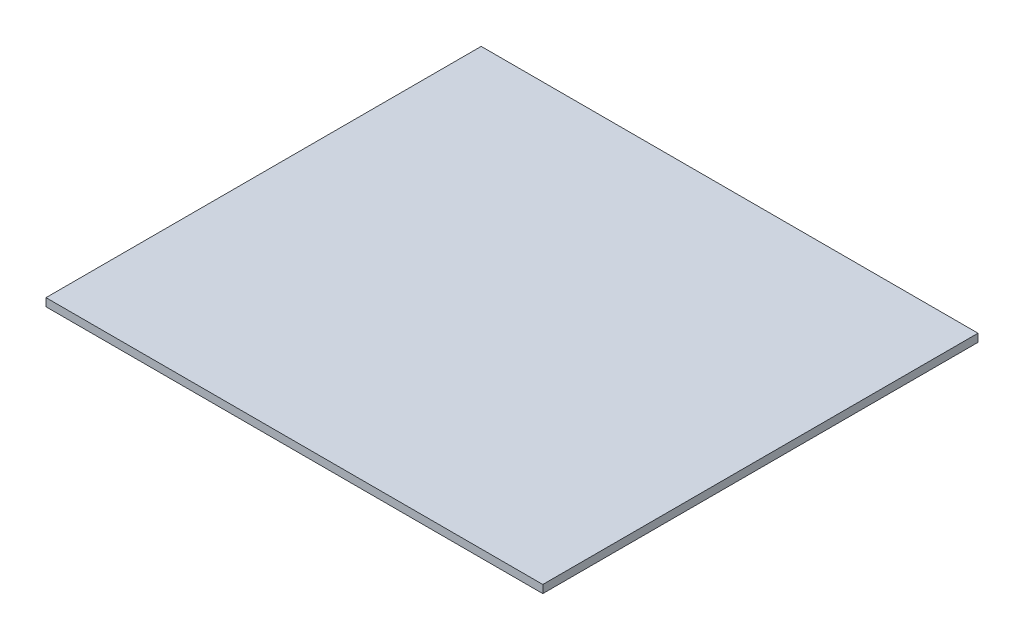
from build123d import *

# Parameters (mm, degrees)
SKETCH1_W           = 250
SKETCH1_H           = 219
BOSS_EXTRUDE1_DEPTH = 4


with BuildPart() as part:
    # Sketch1 → Boss-Extrude1 (new body)
    with BuildSketch(Plane(origin=(0, 0, 0), x_dir=(1, 0, 0), z_dir=(0, 1, 0))):
        Rectangle(SKETCH1_W, SKETCH1_H)
    extrude(amount=BOSS_EXTRUDE1_DEPTH)


solid = part.part
